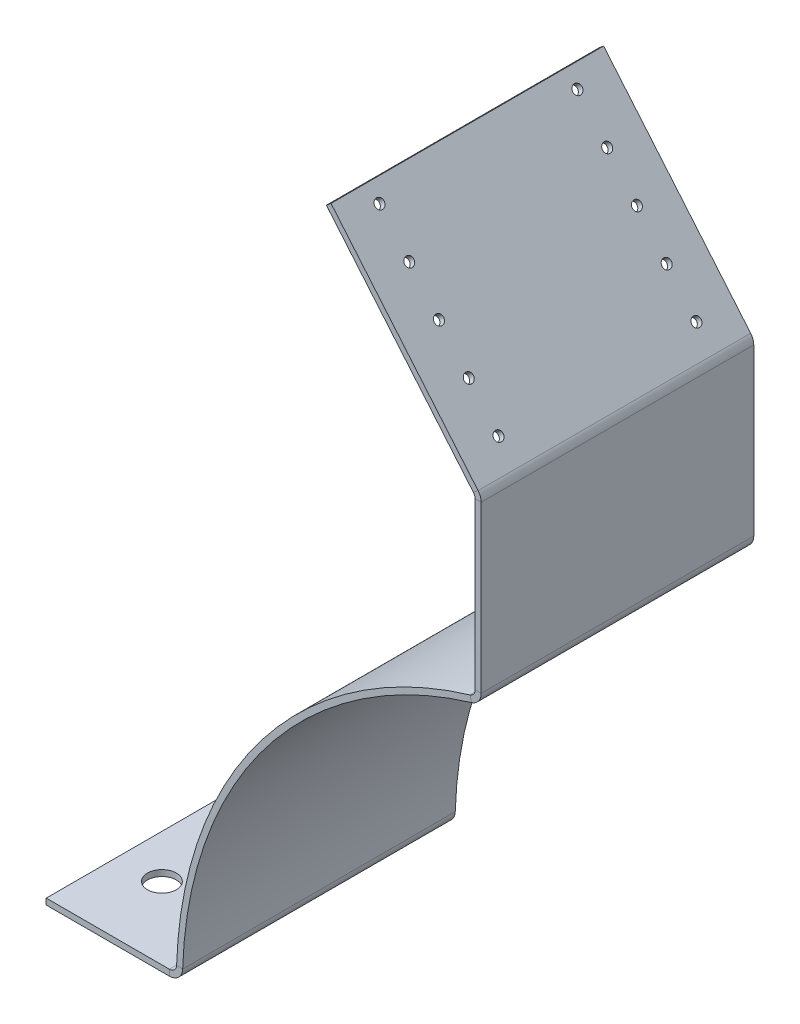
from build123d import *

# Parameters (mm, degrees)
BASE_FLANGE1_DEPTH           = 119.6975
EDGE_FLANGE1_DEPTH           = 119.6975
EDGE_FLANGE2_STRIP_CUT_DEPTH = 119.6975
EDGE_FLANGE2_DEPTH           = 119.6975
EDGE_FLANGE3_DEPTH           = 119.6975
SKETCH20_R                   = 6.35
CUT_EXTRUDE1_DEPTH           = 2.65684
SKETCH21_R                   = 2.032
CUT_EXTRUDE2_DEPTH           = 2.65684


# Sheet-metal steps are written as plain solids
with BuildPart() as part:
    # Sketch1 → Base-Flange1 (new body)
    with BuildSketch(Plane.XY):
        with BuildLine():
            ThreePointArc((-50.8, 170.388379885), (-140.856418383, 108.500273734), (-177.710803869, 5.63118))
            Line((-177.710803869, 5.63118), (-180.366311024, 5.715325918))
            ThreePointArc((-180.366311024, 5.715325918), (-142.961215721, 110.121577824), (-51.559097143, 172.934469105))
            Line((-51.559097143, 172.934469105), (-50.8, 170.388379885))
        make_face()
    extrude(amount=BASE_FLANGE1_DEPTH)

    # Edge-Flange1 section (across the edge) → Edge-Flange1 (add)
    with BuildSketch(Plane(origin=(-49.291175996, 173.610632552, 119.6975), x_dir=(-0.9999999996342678, -2.7045604981568168e-05, 0), z_dir=(0, 0, -1))):
        with BuildLine():
            Line((-2.65684, 2.366572064), (-2.65684, 76.2))
            Line((-2.65684, 76.2), (0, 76.2))
            Line((0, 76.2), (0, 2.366572064))
            ThreePointArc((0, 2.366572064), (0.62936233, 0.469112223), (2.267939433, -0.676102109))
            Line((2.267939433, -0.676102109), (1.508911151, -3.222211858))
            ThreePointArc((1.508911151, -3.222211858), (-1.500827273, -1.118682173), (-2.65684, 2.366572064))
        make_face()
    extrude(amount=EDGE_FLANGE1_DEPTH)

    # Edge-Flange2 strip (across the edge) → Edge-Flange2 strip cut (cut)
    with BuildSketch(Plane(origin=(-49.293236871, 249.810632524, 119.6975), x_dir=(-0.7660270582590358, -0.6428083275868537, 0), z_dir=(0, 0, -1))):
        Polygon((-12.205285278, 10.412383287), (-1.292448625, -2.593029), (0.742808893, -0.885245167), (-10.17002776, 12.12016712), align=None)
    extrude(amount=EDGE_FLANGE2_STRIP_CUT_DEPTH, mode=Mode.SUBTRACT)

    # Edge-Flange2 section (across the edge) → Edge-Flange2 (add)
    with BuildSketch(Plane(origin=(-49.293236871, 249.810632524, 119.6975), x_dir=(-0.7660270582590358, -0.6428083275868537, 0), z_dir=(0, 0, -1))):
        with BuildLine():
            Line((-2.65684, 1.155605494), (-2.65684, 101.6))
            Line((-2.65684, 101.6), (0, 101.6))
            Line((0, 101.6), (0, 1.155605494))
            ThreePointArc((0, 1.155605494), (0.191475929, 0.069691539), (0.742808893, -0.885245167))
            Line((0.742808893, -0.885245167), (-1.292448625, -2.593029))
            ThreePointArc((-1.292448625, -2.593029), (-2.305137014, -0.839001259), (-2.65684, 1.155605494))
        make_face()
    extrude(amount=EDGE_FLANGE2_DEPTH)

    # Edge-Flange3 section (across the edge) → Edge-Flange3 (add)
    with BuildSketch(Plane(origin=(-180.463740314, 2.640617339, 0), x_dir=(8.626632785421055e-05, 0.9999999962790604, 0), z_dir=(0, 0, 1))):
        with BuildLine():
            Line((-2.65684, 3.076251829), (-2.65684, 57.15))
            Line((-2.65684, 57.15), (0, 57.15))
            Line((0, 57.15), (0, 3.076251829))
            ThreePointArc((0, 3.076251829), (0.894756196, 0.86692768), (3.074716973, -0.097164046))
            Line((3.074716973, -0.097164046), (2.990800136, -2.75267845))
            ThreePointArc((2.990800136, -2.75267845), (-1.013351819, -0.981834768), (-2.65684, 3.076251829))
        make_face()
    extrude(amount=EDGE_FLANGE3_DEPTH)

    # Sketch20 → Cut-Extrude1 (cut)
    with BuildSketch(Plane(origin=(0.000226453, 2.625049375, 0), x_dir=(0.9999999962790604, -8.626632785420363e-05, 0), z_dir=(8.626632785420363e-05, 0.9999999962790604, 0))):
        with Locations(Location((-218.563967439, -31.75, 0), (0, 0, 180))):
            Circle(SKETCH20_R)
        with Locations(Location((-218.563967439, -87.9475, 0), (0, 0, 180))):
            Circle(SKETCH20_R)
    extrude(amount=-CUT_EXTRUDE1_DEPTH, mode=Mode.SUBTRACT)

    # Sketch21 → Cut-Extrude2 (cut)
    with BuildSketch(Plane(origin=(94.083750988, 78.949976994, 0), x_dir=(0, 0, 1), z_dir=(-0.7660270582590358, -0.6428083275868537, 0))):
        with Locations(Location((103.30434, 317.017474478, 0), (0, 0, 270))):
            Circle(SKETCH21_R)
        with Locations(Location((103.30434, 296.697474478, 0), (0, 0, 270))):
            Circle(SKETCH21_R)
        with Locations(Location((103.30434, 276.377474478, 0), (0, 0, 270))):
            Circle(SKETCH21_R)
        with Locations(Location((103.30434, 256.057474478, 0), (0, 0, 270))):
            Circle(SKETCH21_R)
        with Locations(Location((103.30434, 235.737474478, 0), (0, 0, 270))):
            Circle(SKETCH21_R)
        with Locations(Location((16.39316, 235.737474478, 0), (0, 0, 270))):
            Circle(SKETCH21_R)
        with Locations(Location((16.39316, 256.057474478, 0), (0, 0, 270))):
            Circle(SKETCH21_R)
        with Locations(Location((16.39316, 276.377474478, 0), (0, 0, 270))):
            Circle(SKETCH21_R)
        with Locations(Location((16.39316, 296.697474478, 0), (0, 0, 270))):
            Circle(SKETCH21_R)
        with Locations(Location((16.39316, 317.017474478, 0), (0, 0, 270))):
            Circle(SKETCH21_R)
    extrude(amount=-CUT_EXTRUDE2_DEPTH, mode=Mode.SUBTRACT)


solid = part.part
